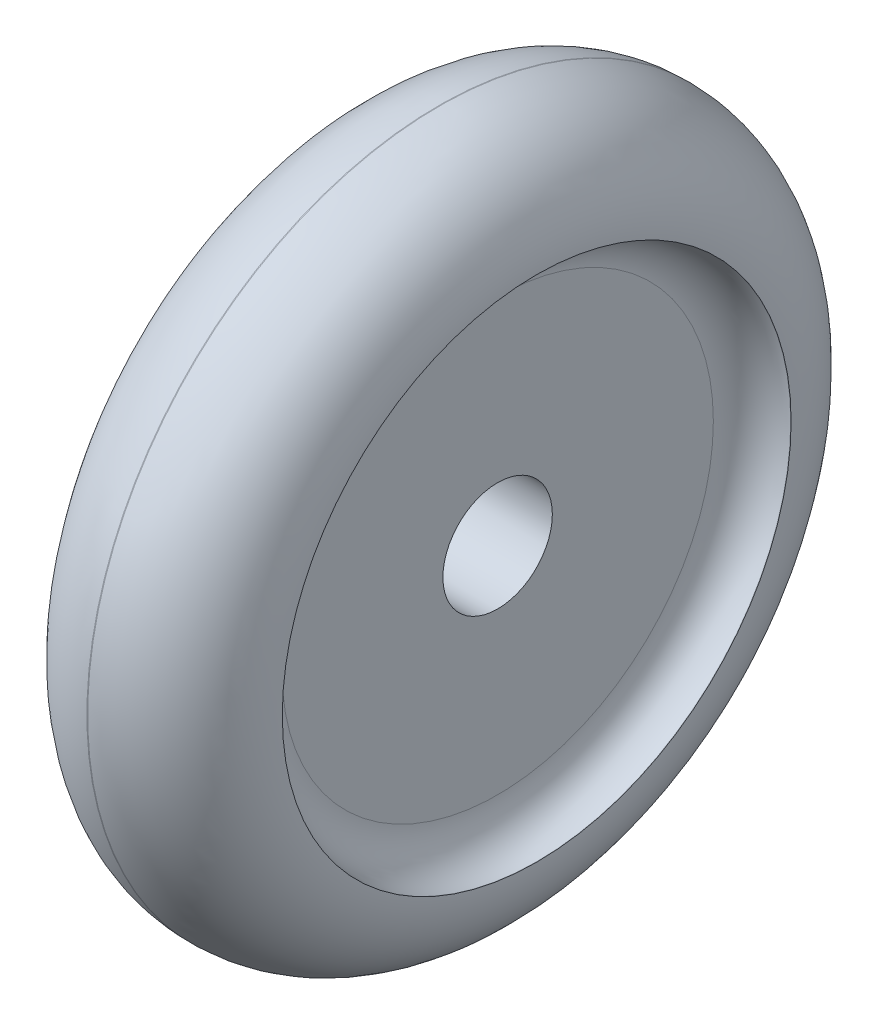
from build123d import *

# Parameters (mm, degrees)
SKETCH2_R           = 9
BOSS_EXTRUDE1_DEPTH = 5
FILLET1_R           = 2.49
SKETCH3_R           = 6.51
CUT_EXTRUDE1_DEPTH  = 1
SKETCH4_R           = 1.4
CUT_EXTRUDE2_DEPTH  = 14.341664132
FILLET2_R           = 0.99


with BuildPart() as part:
    # Sketch2 → Boss-Extrude1 (new body)
    with BuildSketch(Plane(origin=(0, 0, 0), x_dir=(0, 0, -1), z_dir=(1, 0, 0))):
        Circle(SKETCH2_R)
    extrude(amount=BOSS_EXTRUDE1_DEPTH)

    # Fillet1
    fillet1_edges = [part.edges().sort_by_distance(p)[0] for p in [
        (0, 0, 9),
        (5, 0, 9),
    ]]
    fillet(fillet1_edges, radius=FILLET1_R)

    # Sketch3 → Cut-Extrude1 (cut)
    with BuildSketch(Plane(origin=(5, 0, 0), x_dir=(0, 0, -1), z_dir=(1, 0, 0))):
        Circle(SKETCH3_R)
    cut_extrude1 = extrude(amount=-CUT_EXTRUDE1_DEPTH, mode=Mode.SUBTRACT)

    # Mirror1: Cut-Extrude1 across plane
    add(cut_extrude1.mirror(Plane(origin=(2.5, 0, 0), x_dir=(0, 0, 1), z_dir=(1, 0, 0))), mode=Mode.SUBTRACT)

    # Sketch4 → Cut-Extrude2 (cut, through all)
    with BuildSketch(Plane.ZY.offset(-1)):
        Circle(SKETCH4_R)
    extrude(amount=-CUT_EXTRUDE2_DEPTH, mode=Mode.SUBTRACT)

    # Fillet2
    fillet2_edges = [part.edges().sort_by_distance(p)[0] for p in [
        (4, 0, 6.51),
        (1, 0, 6.51),
    ]]
    fillet(fillet2_edges, radius=FILLET2_R)


solid = part.part
